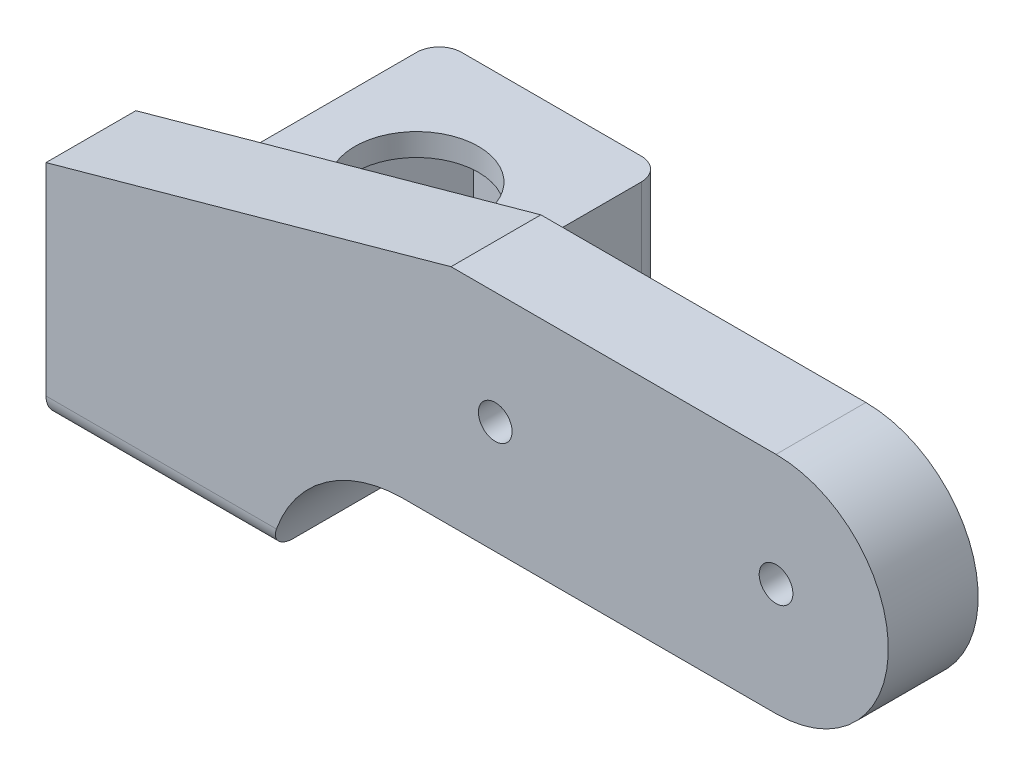
from build123d import *

# Parameters (mm, degrees)
BOSS_EXTRUDE1_DEPTH      = 8
SKETCH2_R                = 1.5
CUT_EXTRUDE1_DEPTH       = 10
SKETCH3_R                = 1.5
CUT_EXTRUDE2_DEPTH       = 10
BOSS_EXTRUDE3_DEPTH      = 30
BOSS_EXTRUDE3_DEPTH_BACK = 8
SKETCH6_W                = 20
SKETCH6_H                = 10
FILLET3_R                = 12
SKETCH7_W                = 20
SKETCH7_H                = 30
BOSS_EXTRUDE4_DEPTH      = 2
CUT_EXTRUDE3_DEPTH       = 10
SKETCH9_R                = 5.5
CUT_EXTRUDE4_DEPTH       = 10
FILLET4_R                = 5
FILLET5_R                = 2
CUT_EXTRUDE5_DEPTH       = 10
SKETCH11_W               = 20
SKETCH11_H               = 3
CUT_EXTRUDE6_DEPTH       = 15
FILLET6_R                = 2


with BuildPart() as part:
    # Sketch1 → Boss-Extrude1 (new body)
    with BuildSketch(Plane.XY):
        with BuildLine():
            Line((-25, 10), (40, 10))
            ThreePointArc((40, 10), (50, 0), (40, -10))
            Line((40, -10), (-25, -10))
            Line((-25, -10), (-25, 10))
        make_face()
    extrude(amount=BOSS_EXTRUDE1_DEPTH)

    # Sketch2 → Cut-Extrude1 (cut)
    with BuildSketch(Plane.XY.offset(8)):
        with Locations((40, 0)):
            Circle(SKETCH2_R)
    extrude(amount=-CUT_EXTRUDE1_DEPTH, mode=Mode.SUBTRACT)

    # Sketch3 → Cut-Extrude2 (cut)
    with BuildSketch(Plane(origin=(0, 0, 0), x_dir=(-1, 0, 0), z_dir=(0, 0, -1))):
        with Locations((-15, 0)):
            Circle(SKETCH3_R)
    extrude(amount=-CUT_EXTRUDE2_DEPTH, mode=Mode.SUBTRACT)

    # Sketch6 → Boss-Extrude3 (add, two sides: drawn at the far end of the back side and taken through both)
    with BuildSketch(Plane(origin=(0, 0, 0), x_dir=(-1, 0, 0), z_dir=(0, 0, -1)).offset(-BOSS_EXTRUDE3_DEPTH_BACK)):
        with Locations((15, -15)):
            Rectangle(SKETCH6_W, SKETCH6_H)
    extrude(amount=BOSS_EXTRUDE3_DEPTH + BOSS_EXTRUDE3_DEPTH_BACK)

    # Fillet3
    # the kernel refuses this fillet: 12 mm, written as the material it adds along each edge
    with BuildSketch(Plane(origin=(-5, -10, 8), x_dir=(0, -1, 0), z_dir=(0, 0, -1))) as fillet3_piece_1:
        with BuildLine():
            CenterArc((12, -11.832159566), FILLET3_R, 99.594068227, 80.405931773)
            Line((0, -11.832159566), (0, 0))
            Line((0, 0), (10, 0))
        make_face()
    extrude(amount=8)

    # Sketch7 → Boss-Extrude4 (add)
    with BuildSketch(Plane(origin=(0, -10, 0), x_dir=(1, 0, 0), z_dir=(0, 1, 0))):
        with Locations((-15, 15)):
            Rectangle(SKETCH7_W, SKETCH7_H)
    extrude(amount=BOSS_EXTRUDE4_DEPTH)

    # Sketch8 → Cut-Extrude3 (cut)
    with BuildSketch(Plane.XZ.offset(20)):
        Polygon((-12.092828782, -7.012612723), (-20.463694682, -8.488622233), (-23.370865901, -16.47600951), (-17.907171218, -22.987387277), (-9.536305318, -21.511377767), (-6.629134099, -13.52399049), align=None)
    extrude(amount=-CUT_EXTRUDE3_DEPTH, mode=Mode.SUBTRACT)

    # Sketch9 → Cut-Extrude4 (cut)
    with BuildSketch(Plane.XZ.offset(10)):
        with Locations(Location((-15, -15, 0), (0, 0, 270))):
            Circle(SKETCH9_R)
    extrude(amount=-CUT_EXTRUDE4_DEPTH, mode=Mode.SUBTRACT)

    # Fillet4
    # the kernel refuses this fillet: 5 mm, written as the material it adds along each edge
    with BuildSketch(Plane(origin=(-5, -20, 0), x_dir=(1, 0, 0), z_dir=(0, 1, 0))) as fillet4_piece_1_section:
        with BuildLine():
            CenterArc((FILLET4_R, FILLET4_R), FILLET4_R, 180, 90)
            Line((0, FILLET4_R), (0, 0))
            Line((0, 0), (FILLET4_R, 0))
        make_face()
    fillet4_piece_1 = extrude(amount=12, mode=Mode.PRIVATE)
    fillet4_piece_1 = fillet4_piece_1 - Plane(origin=(6.832159566, -22, 0), x_dir=(0, -1, 0), z_dir=(0, 0, 1)) * Cylinder(12, 44, mode=Mode.PRIVATE)
    add(fillet4_piece_1)
    with BuildSketch(Plane(origin=(-25, -8, 0), x_dir=(0, 1, 0), z_dir=(1, 0, 0))) as fillet4_piece_2:
        with BuildLine():
            CenterArc((FILLET4_R, -FILLET4_R), FILLET4_R, 90, 90)
            Line((0, -FILLET4_R), (0, 0))
            Line((0, 0), (FILLET4_R, 0))
        make_face()
    extrude(amount=20)
    with BuildSketch(Plane(origin=(-5, -20, 0), x_dir=(1, 0, 0), z_dir=(0, 1, 0))) as fillet4_piece_3a_section:
        with BuildLine():
            CenterArc((FILLET4_R, FILLET4_R), FILLET4_R, 180, 90)
            Line((0, FILLET4_R), (0, 0))
            Line((0, 0), (FILLET4_R, 0))
        make_face()
    fillet4_piece_3a = extrude(amount=24.5, mode=Mode.PRIVATE)
    fillet4_piece_3a = split(fillet4_piece_3a, bisect_by=Plane(origin=(-5, -8, 0), z_dir=(0, 1, 0)), keep=Keep.TOP, mode=Mode.PRIVATE)
    with BuildSketch(Plane(origin=(-25, -8, 0), x_dir=(0, 1, 0), z_dir=(1, 0, 0))) as fillet4_piece_3b_section:
        with BuildLine():
            CenterArc((FILLET4_R, -FILLET4_R), FILLET4_R, 90, 90)
            Line((0, -FILLET4_R), (0, 0))
            Line((0, 0), (FILLET4_R, 0))
        make_face()
    fillet4_piece_3b = extrude(amount=32.5, mode=Mode.PRIVATE)
    fillet4_piece_3b = split(fillet4_piece_3b, bisect_by=Plane(origin=(-5, -8, 0), z_dir=(1, 0, 0)), keep=Keep.TOP, mode=Mode.PRIVATE)
    fillet4_piece_3 = fillet4_piece_3a & fillet4_piece_3b
    add(fillet4_piece_3)

    # Fillet5
    fillet5_edges = [part.edges().sort_by_distance(p)[0] for p in [
        (-15, -20, 8),
        (-25, -14, -30),
        (-5, -14, -30),
        (-25, 10, 4),
    ]]
    fillet(fillet5_edges, radius=FILLET5_R)

    # Sketch10 → Cut-Extrude5 (cut)
    with BuildSketch(Plane.XY.offset(8)):
        with BuildLine():
            Line((-25, 0), (11.061986304, 10))
            Line((11.061986304, 10), (-23, 10))
            ThreePointArc((-23, 10), (-24.414213562, 9.414213562), (-25, 8))
            Line((-25, 8), (-25, 0))
        make_face()
    extrude(amount=-CUT_EXTRUDE5_DEPTH, mode=Mode.SUBTRACT)

    # Sketch11 → Cut-Extrude6 (cut)
    with BuildSketch(Plane.XZ.offset(20)):
        with Locations((-15, -28.5)):
            Rectangle(SKETCH11_W, SKETCH11_H)
    extrude(amount=-CUT_EXTRUDE6_DEPTH, mode=Mode.SUBTRACT)

    # Fillet6
    fillet6_edges = [part.edges().sort_by_distance(p)[0] for p in [
        (-25, -14, -27),
        (-5, -14, -27),
    ]]
    fillet(fillet6_edges, radius=FILLET6_R)


solid = part.part
